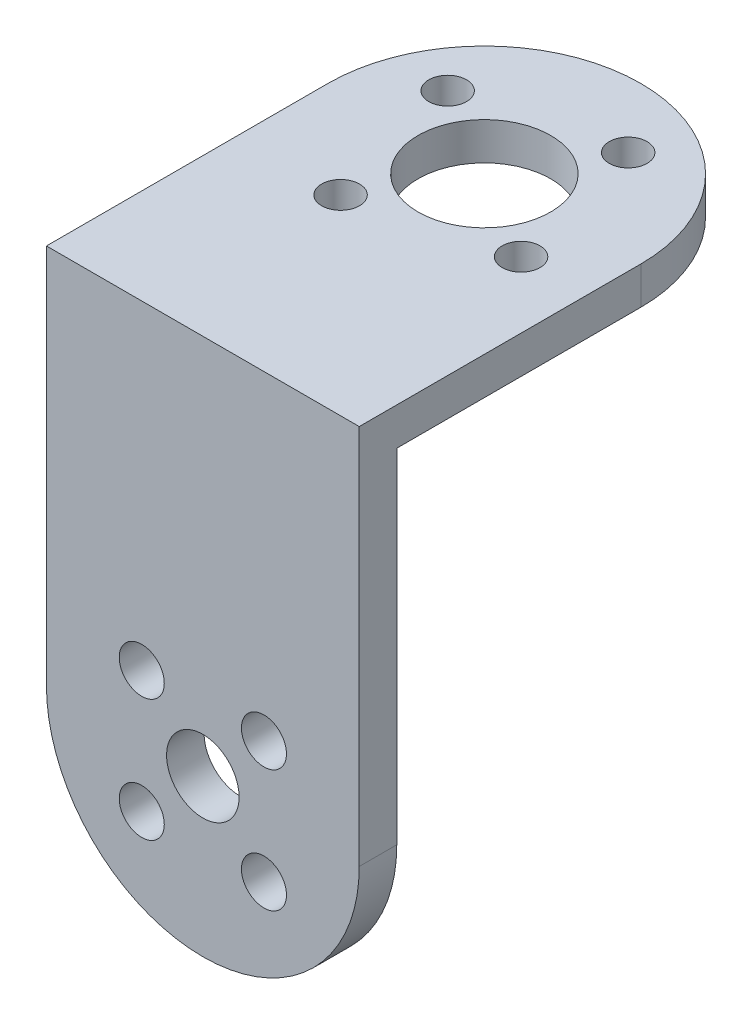
from build123d import *

# Parameters (mm, degrees)
CROQUIS1_R              = 5.3
CROQUIS1_R_2            = 1.511434147
SALIENTE_EXTRUIR1_DEPTH = 3
CROQUIS3_R              = 1.8
CROQUIS3_R_2            = 2.898354149
SALIENTE_EXTRUIR2_DEPTH = 3


with BuildPart() as part:
    # Croquis1 → Saliente-Extruir1 (new body)
    with BuildSketch(Plane(origin=(0, 0, 0), x_dir=(1, 0, 0), z_dir=(0, 1, 0))):
        with BuildLine():
            Line((-12.5, 9.75), (-12.5, -9.75))
            Line((-12.5, -9.75), (12.5, -9.75))
            Line((12.5, -9.75), (12.5, 9.75))
            ThreePointArc((12.5, 9.75), (0, 22.25), (-12.5, 9.75))
        make_face()
        with Locations((0, 9.75)):
            Circle(CROQUIS1_R, mode=Mode.SUBTRACT)
        with Locations((4.279075226, 16.962926707)):
            Circle(CROQUIS1_R_2, mode=Mode.SUBTRACT)
        with Locations((7.212926707, 5.470924774)):
            Circle(CROQUIS1_R_2, mode=Mode.SUBTRACT)
        with Locations((-4.279075226, 2.537073293)):
            Circle(CROQUIS1_R_2, mode=Mode.SUBTRACT)
        with Locations((-7.212926707, 14.029075226)):
            Circle(CROQUIS1_R_2, mode=Mode.SUBTRACT)
    extrude(amount=SALIENTE_EXTRUIR1_DEPTH)

    # Croquis3 → Saliente-Extruir2 (add)
    with BuildSketch(Plane.XY.offset(9.75)):
        with BuildLine():
            Line((12.5, 3), (-12.5, 3))
            Line((-12.5, 3), (-12.5, -27.448061217))
            ThreePointArc((-12.5, -27.448061217), (0, -39.948061217), (12.5, -27.448061217))
            Line((12.5, -27.448061217), (12.5, 3))
        make_face()
        with Locations((-4.883019317, -32.331080533)):
            Circle(CROQUIS3_R, mode=Mode.SUBTRACT)
        with Locations((-4.883019317, -22.5650419)):
            Circle(CROQUIS3_R, mode=Mode.SUBTRACT)
        with Locations((4.883019317, -22.5650419)):
            Circle(CROQUIS3_R, mode=Mode.SUBTRACT)
        with Locations((4.883019317, -32.331080533)):
            Circle(CROQUIS3_R, mode=Mode.SUBTRACT)
        with Locations((0, -27.448061217)):
            Circle(CROQUIS3_R_2, mode=Mode.SUBTRACT)
    extrude(amount=SALIENTE_EXTRUIR2_DEPTH)


solid = part.part
